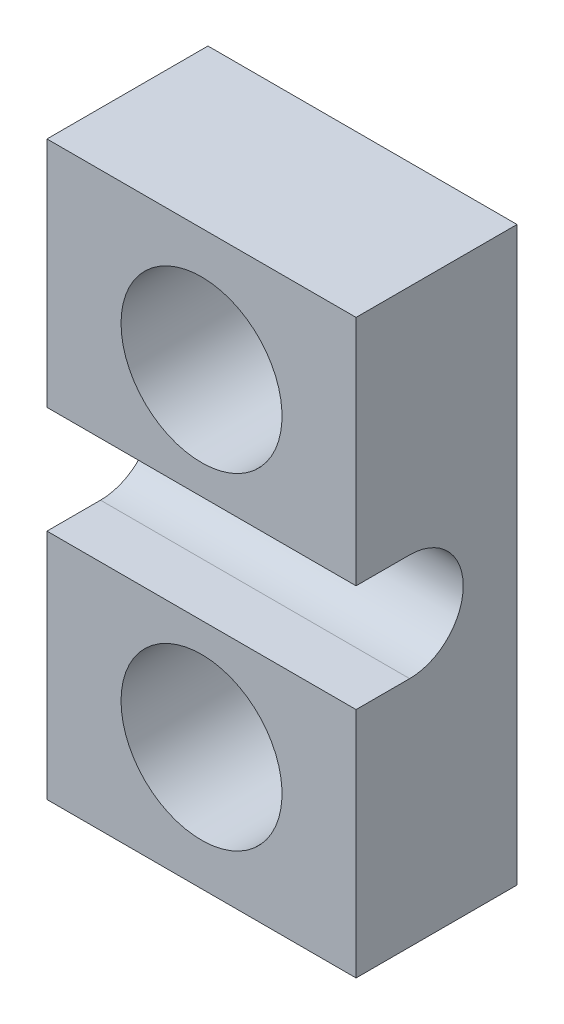
from build123d import *

# Parameters (mm, degrees)
SKETCH1_W           = 6.14482622
SKETCH1_H           = 11.373318705
BOSS_EXTRUDE1_DEPTH = 3.2
SKETCH2_R           = 1.6
CUT_EXTRUDE1_DEPTH  = 261.036225732
CUT_EXTRUDE2_DEPTH  = 145.0912201


with BuildPart() as part:
    # Sketch1 → Boss-Extrude1 (new body)
    with BuildSketch(Plane.XY):
        with Locations((213.478545955, 138.237907074)):
            Rectangle(SKETCH1_W, SKETCH1_H)
    extrude(amount=BOSS_EXTRUDE1_DEPTH)

    # Sketch2 → Cut-Extrude1 (cut, through all)
    with BuildSketch(Plane(origin=(0, 0, 0), x_dir=(-1, 0, 0), z_dir=(0, 0, -1))):
        with Locations((-213.478545955, 141.487907073)):
            Circle(SKETCH2_R)
        with Locations((-213.478545955, 134.987907073)):
            Circle(SKETCH2_R)
    extrude(amount=-CUT_EXTRUDE1_DEPTH, mode=Mode.SUBTRACT)

    # Sketch3 → Cut-Extrude2 (cut, through all)
    with BuildSketch(Plane(origin=(216.550959065, 0, 0), x_dir=(0, 0, -1), z_dir=(1, 0, 0))):
        with BuildLine():
            Line((-2.135, 137.172907073), (-3.2, 137.172907073))
            Line((-3.2, 137.172907073), (-3.2, 139.302907073))
            Line((-3.2, 139.302907073), (-2.135, 139.302907073))
            ThreePointArc((-2.135, 139.302907073), (-1.07, 138.237907073), (-2.135, 137.172907073))
        make_face()
    extrude(amount=-CUT_EXTRUDE2_DEPTH, mode=Mode.SUBTRACT)


solid = part.part
